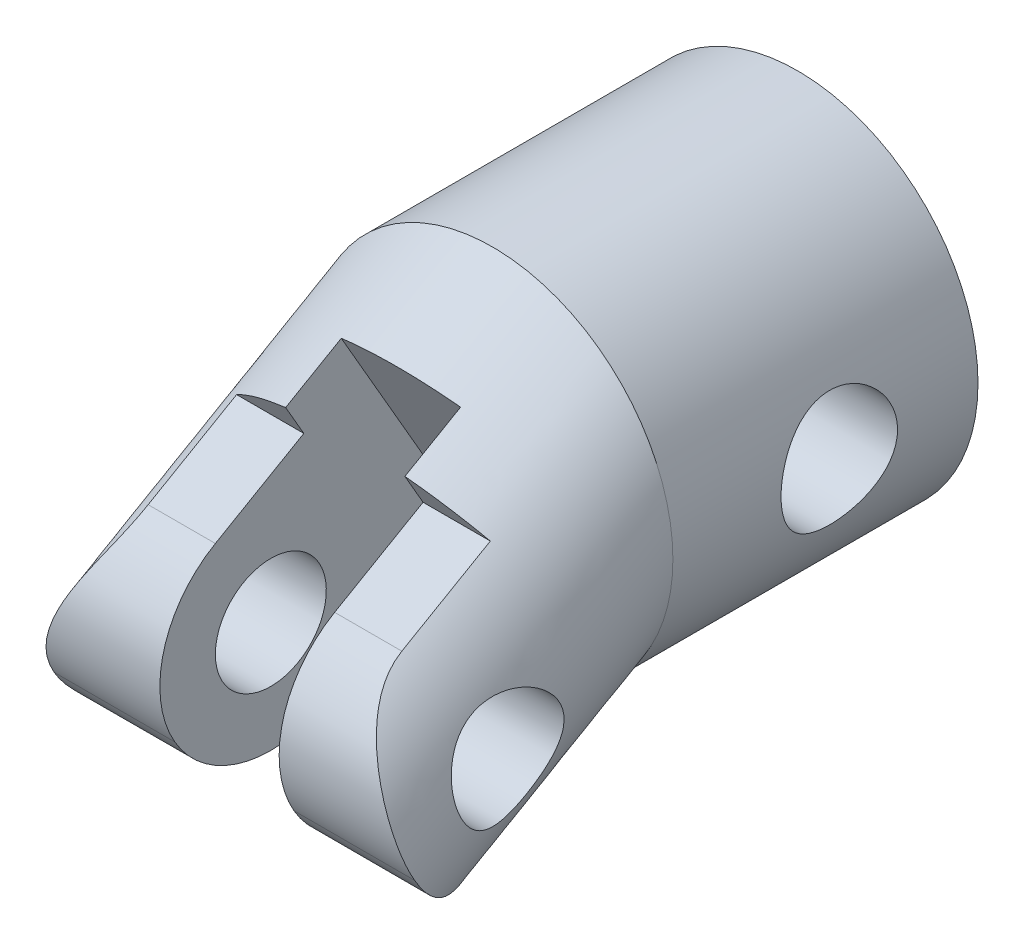
from build123d import *

# Parameters (mm, degrees)
BOSS_EXTRUDE1_DEPTH      = 5
BOSS_EXTRUDE1_DEPTH_BACK = 5
SKETCH1_R                = 6.5
SKETCH1_R_2              = 4.5
SKETCH2_R                = 6.5
BOSS_EXTRUDE2_DEPTH      = 1
CUT_EXTRUDE1_START       = -8
CUT_EXTRUDE1_DEPTH       = 15
SKETCH6_W                = 4.3
SKETCH6_H                = 17.25833025
CUT_EXTRUDE2_DEPTH       = 10
CUT_EXTRUDE3_DEPTH       = 22.553121401
CUT_EXTRUDE3_DEPTH_BACK  = 22.553121401
SKETCH7_R                = 2
SKETCH8_W                = 9.14694849
SKETCH8_H                = 3.258330249
CUT_EXTRUDE4_DEPTH       = 7.682935
FILLET2_R                = 4
BOSS_EXTRUDE4_REACH      = 25.047
CUT_EXTRUDE5_DEPTH       = 19.647410958
CUT_EXTRUDE5_DEPTH_BACK  = 19.647410958
SKETCH10_R               = 2.1


with BuildPart() as part:
    # Sketch1 → Boss-Extrude1 (new, two sides: drawn at the far end of the back side and taken through both)
    with BuildSketch(Plane.XY.offset(-BOSS_EXTRUDE1_DEPTH_BACK)):
        Circle(SKETCH1_R)
        Circle(SKETCH1_R_2, mode=Mode.SUBTRACT)
    extrude(amount=BOSS_EXTRUDE1_DEPTH + BOSS_EXTRUDE1_DEPTH_BACK)

    # Sketch2 → Boss-Extrude2 (add)
    with BuildSketch(Plane.XY.offset(5)):
        Circle(SKETCH2_R)
    extrude(amount=BOSS_EXTRUDE2_DEPTH)

    # Sweep1: read off the stored shape, not the designer's step
    # Sweep1: loft between two sections, ruled curve by curve
    sweep1_from = [
        Edge.make_bspline([(6.5, 0, 6), (6.5, 13, 6), (-6.5, 13, 6), (-6.5, 0, 6), (-6.5, -13, 6), (6.5, -13, 6), (6.5, 0, 6)], [0, 0, 0, 0, 0.5, 0.5, 0.5, 1, 1, 1, 1], 3, [1, 0.333333333, 0.333333333, 1, 0.333333333, 0.333333333, 1]),
    ]
    sweep1_to = [
        Edge.make_bspline([(6.5, -7, 18.124355653), (6.5, 6, 18.124355653), (-6.5, 6, 18.124355653), (-6.5, -7, 18.124355653), (-6.5, -20, 18.124355653), (6.5, -20, 18.124355653), (6.5, -7, 18.124355653)], [0, 0, 0, 0, 0.5, 0.5, 0.5, 1, 1, 1, 1], 3, [1, 0.333333333, 0.333333333, 1, 0.333333333, 0.333333333, 1]),
    ]
    sweep1 = Solid(Shell([*[Face.make_surface_from_curves(sweep1_from[k], sweep1_to[k]) for k in range(1)], Face(Wire(sweep1_from)), Face(Wire(sweep1_to))]))
    add(sweep1)

    # Cut-Extrude1: read off the stored shape, not the designer's step
    # Cut-Extrude1 outline → Cut-Extrude1 (cut)
    with BuildSketch(Plane(origin=(0, 0, 0), x_dir=(0, 0, -1), z_dir=(1, 0, 0)).offset(CUT_EXTRUDE1_START)):
        Polygon((-12.495190528, -10.25), (-18.124355653, -0.5), (-18.124355653, -13.5), align=None)
    extrude(amount=CUT_EXTRUDE1_DEPTH, mode=Mode.SUBTRACT)

    # Sketch6 → Cut-Extrude2 (cut)
    with BuildSketch(Plane(origin=(0, -7.973076211, 13.809773091), x_dir=(1, 0, 0), z_dir=(0, -0.5000000000000006, 0.8660254037844384))):
        Rectangle(SKETCH6_W, SKETCH6_H)
    extrude(amount=-CUT_EXTRUDE2_DEPTH, mode=Mode.SUBTRACT)

    # Sketch7 → Cut-Extrude3 (cut, two sides: drawn at the far end of the back side and taken through both)
    with BuildSketch(Plane(origin=(0, 0, 0), x_dir=(0, 0, -1), z_dir=(1, 0, 0)).offset(-CUT_EXTRUDE3_DEPTH_BACK)):
        with Locations(Location((-11.845671476, -3.375, 0), (0, 0, 30))):
            Circle(SKETCH7_R)
    extrude(amount=CUT_EXTRUDE3_DEPTH + CUT_EXTRUDE3_DEPTH_BACK, mode=Mode.SUBTRACT)

    # Sketch8 → Cut-Extrude4 (cut)
    with BuildSketch(Plane(origin=(0, -7.973076211, 13.809773091), x_dir=(1, 0, 0), z_dir=(0, -0.5000000000000004, 0.8660254037844384))):
        with Locations((0, 8.629165125)):
            Rectangle(SKETCH8_W, SKETCH8_H)
        with Locations((0, -2.629165125)):
            Rectangle(SKETCH8_W, SKETCH8_H)
    extrude(amount=-CUT_EXTRUDE4_DEPTH, mode=Mode.SUBTRACT)

    # Fillet2
    # the kernel refuses this fillet: 4 mm, written as the material it takes off along each edge
    with BuildSketch(Plane(origin=(14.573474245, -1.910898385, 17.309773091), x_dir=(0, -0.8660254037646593, -0.5000000000342589), z_dir=(-1, 0, 0)), Plane(origin=(7.85, -1.910898385, 17.309773091), x_dir=(0, -0.8660254037646593, -0.5000000000342589), z_dir=(-1, 0, 0)), Plane(origin=(14.573474245, -8.839101615, 13.309773091), x_dir=(0, 0.5000000000000003, -0.8660254037844386), z_dir=(-1, 0, 0))) as fillet2_piece_1:
        with BuildLine():
            CenterArc((FILLET2_R, -FILLET2_R), FILLET2_R, 90, 90.000000002)
            Line((FILLET2_R * 3.95581923922e-11, -FILLET2_R), (0, 0))
            Line((0, 0), (FILLET2_R, 0))
        make_face()
    extrude(amount=22.423474245, mode=Mode.SUBTRACT)
    with BuildSketch(Plane(origin=(7.85, -8.839101615, 13.309773091), x_dir=(0, 0.8660254038042173, 0.49999999996574257), z_dir=(-1, 0, 0))) as fillet2_piece_2:
        with BuildLine():
            CenterArc((FILLET2_R, FILLET2_R), FILLET2_R, 179.999999998, 89.999999998)
            Line((FILLET2_R * 3.95576715485e-11, FILLET2_R), (0, 0))
            Line((0, 0), (FILLET2_R, 0))
        make_face()
    extrude(amount=22.423474245, mode=Mode.SUBTRACT)

    # Sketch9 → Boss-Extrude4 (add, up to next)
    with BuildSketch(Plane(origin=(0, 0, -5), x_dir=(-1, 0, 0), z_dir=(0, 0, -1)), mode=Mode.PRIVATE) as boss_extrude4_sk1:
        with BuildLine():
            Line((-3.15, 3.213642793), (-3.15, -3.213642793))
            ThreePointArc((-3.15, -3.213642793), (-4.5, 0), (-3.15, 3.213642793))
        make_face()
    boss_extrude4_tool1 = extrude(boss_extrude4_sk1.sketch, amount=-BOSS_EXTRUDE4_REACH, mode=Mode.PRIVATE) - part.part
    # Sketch9 → Boss-Extrude4 (add, up to next)
    with BuildSketch(Plane(origin=(0, 0, -5), x_dir=(-1, 0, 0), z_dir=(0, 0, -1)), mode=Mode.PRIVATE) as boss_extrude4_sk2:
        with BuildLine():
            Line((3.15, 3.213642793), (3.15, -3.213642793))
            ThreePointArc((3.15, -3.213642793), (4.5, 0), (3.15, 3.213642793))
        make_face()
    boss_extrude4_tool2 = extrude(boss_extrude4_sk2.sketch, amount=-BOSS_EXTRUDE4_REACH, mode=Mode.PRIVATE) - part.part
    add(boss_extrude4_tool1.solids().sort_by_distance((3.697607, 0, -5))[0])
    add(boss_extrude4_tool2.solids().sort_by_distance((-3.697607, 0, -5))[0])

    # Sketch10 → Cut-Extrude5 (cut, two sides: drawn at the far end of the back side and taken through both)
    with BuildSketch(Plane(origin=(0, 0, 0), x_dir=(0, 0, -1), z_dir=(1, 0, 0)).offset(-CUT_EXTRUDE5_DEPTH_BACK)):
        Circle(SKETCH10_R)
    extrude(amount=CUT_EXTRUDE5_DEPTH + CUT_EXTRUDE5_DEPTH_BACK, mode=Mode.SUBTRACT)


solid = part.part
